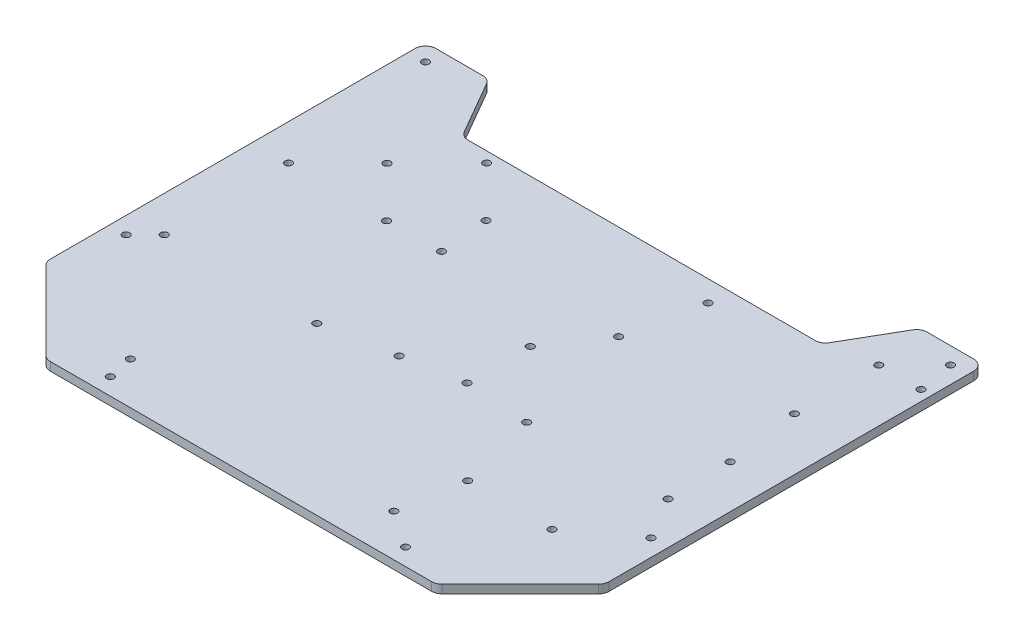
from build123d import *

# Parameters (mm, degrees)
MAIN_EXTRUSION_DEPTH    = 4
CONG_1_R                = 5
ESQUISSE1_R             = 1
ENL_V_MAT_EXTRU_1_DEPTH = 257.850637531
D_GAGEMENT_M31_D        = 3.4
ESQUISSE4_R             = 1
ENL_V_MAT_EXTRU_2_DEPTH = 257.850637531
D_GAGEMENT_M32_D        = 3.4


with BuildPart() as part:
    # Main scetch → Main extrusion (new body)
    with BuildSketch(Plane(origin=(0, 0, 0), x_dir=(1, 0, 0), z_dir=(0, 1, 0))):
        Polygon((-92.5, 0), (92.5, 0), (132.5, 40), (132.5, 220), (102.5, 220), (85.179491924, 190), (-85.179491924, 190), (-102.5, 220), (-132.5, 220), (-132.5, 40), align=None)
    extrude(amount=MAIN_EXTRUSION_DEPTH)

    # Congé1
    cong_1_edges = [part.edges().sort_by_distance(p)[0] for p in [
        (-132.5, 2, -40),
        (-92.5, 2, 0),
        (92.5, 2, 0),
        (132.5, 2, -40),
        (132.5, 2, -220),
        (102.5, 2, -220),
        (85.179491924, 2, -190),
        (-85.179491924, 2, -190),
        (-102.5, 2, -220),
        (-132.5, 2, -220),
    ]]
    fillet(cong_1_edges, radius=CONG_1_R)

    # Esquisse1 → Enlèv. mat.-Extru.1 (cut, through all)
    with BuildSketch(Plane(origin=(0, 4, 0), x_dir=(1, 0, 0), z_dir=(0, 1, 0))):
        with Locations((70, 8)):
            Circle(ESQUISSE1_R)
        with Locations((124.5, 70)):
            Circle(ESQUISSE1_R)
        with Locations((124.5, 212)):
            Circle(ESQUISSE1_R)
        with Locations((-124.5, 212)):
            Circle(ESQUISSE1_R)
        with Locations((-124.5, 70)):
            Circle(ESQUISSE1_R)
        with Locations((-70, 8)):
            Circle(ESQUISSE1_R)
    extrude(amount=-ENL_V_MAT_EXTRU_1_DEPTH, mode=Mode.SUBTRACT)

    # Dégagement M31 (through all)
    with Locations(Plane(origin=(0, 4, 0), x_dir=(1, 0, 0), z_dir=(0, 1, 0))):
        with Locations((-124.5, 212), (-124.5, 70), (-70, 8), (70, 8), (124.5, 70), (124.5, 212)):
            Hole(D_GAGEMENT_M31_D / 2)

    # Esquisse4 → Enlèv. mat.-Extru.2 (cut, through all)
    with BuildSketch(Plane(origin=(0, 4, 0), x_dir=(1, 0, 0), z_dir=(0, 1, 0))):
        with Locations((-68.5, 185)):
            Circle(ESQUISSE4_R)
        with Locations((41.5, 180)):
            Circle(ESQUISSE4_R)
        with Locations((34.12, 145)):
            Circle(ESQUISSE4_R)
        with Locations((107.5, 155)):
            Circle(ESQUISSE4_R)
        with Locations((127.5, 195)):
            Circle(ESQUISSE4_R)
        with Locations((112, 120)):
            Circle(ESQUISSE4_R)
        with Locations((112.5, 90)):
            Circle(ESQUISSE4_R)
        with Locations((17.2, 120)):
            Circle(ESQUISSE4_R)
        with Locations((17.2, 90)):
            Circle(ESQUISSE4_R)
        with Locations((47.5, 88)):
            Circle(ESQUISSE4_R)
        with Locations((57.5, 50)):
            Circle(ESQUISSE4_R)
        with Locations((97.5, 50)):
            Circle(ESQUISSE4_R)
        with Locations((52.5, 20)):
            Circle(ESQUISSE4_R)
        with Locations((-10, 85)):
            Circle(ESQUISSE4_R)
        with Locations((-72.5, 20)):
            Circle(ESQUISSE4_R)
        with Locations((107.5, 195)):
            Circle(ESQUISSE4_R)
        with Locations((-68.5, 137.5)):
            Circle(ESQUISSE4_R)
        with Locations((-92, 161.25)):
            Circle(ESQUISSE4_R)
        with Locations((-45, 161.25)):
            Circle(ESQUISSE4_R)
        with Locations((-115.5, 138)):
            Circle(ESQUISSE4_R)
        with Locations((-42.86, 138)):
            Circle(ESQUISSE4_R)
        with Locations((-115.5, 79.07)):
            Circle(ESQUISSE4_R)
        with Locations((-42.890430383, 78.82)):
            Circle(ESQUISSE4_R)
    extrude(amount=-ENL_V_MAT_EXTRU_2_DEPTH, mode=Mode.SUBTRACT)

    # Dégagement M32 (through all)
    with Locations(Plane(origin=(0, 4, 0), x_dir=(1, 0, 0), z_dir=(0, 1, 0))):
        with Locations((-68.5, 185), (17.2, 120), (34.12, 145), (41.5, 180), (107.5, 155), (127.5, 195), (112, 120), (112.5, 90), (47.5, 88), (17.2, 90), (57.5, 50), (97.5, 50), (-10, 85), (-72.5, 20), (52.5, 20), (107.5, 195), (-68.5, 137.5), (-92, 161.25), (-45, 161.25), (-115.5, 138), (-42.86, 138), (-115.5, 79.07), (-42.890430383, 78.82)):
            Hole(D_GAGEMENT_M32_D / 2)


solid = part.part
